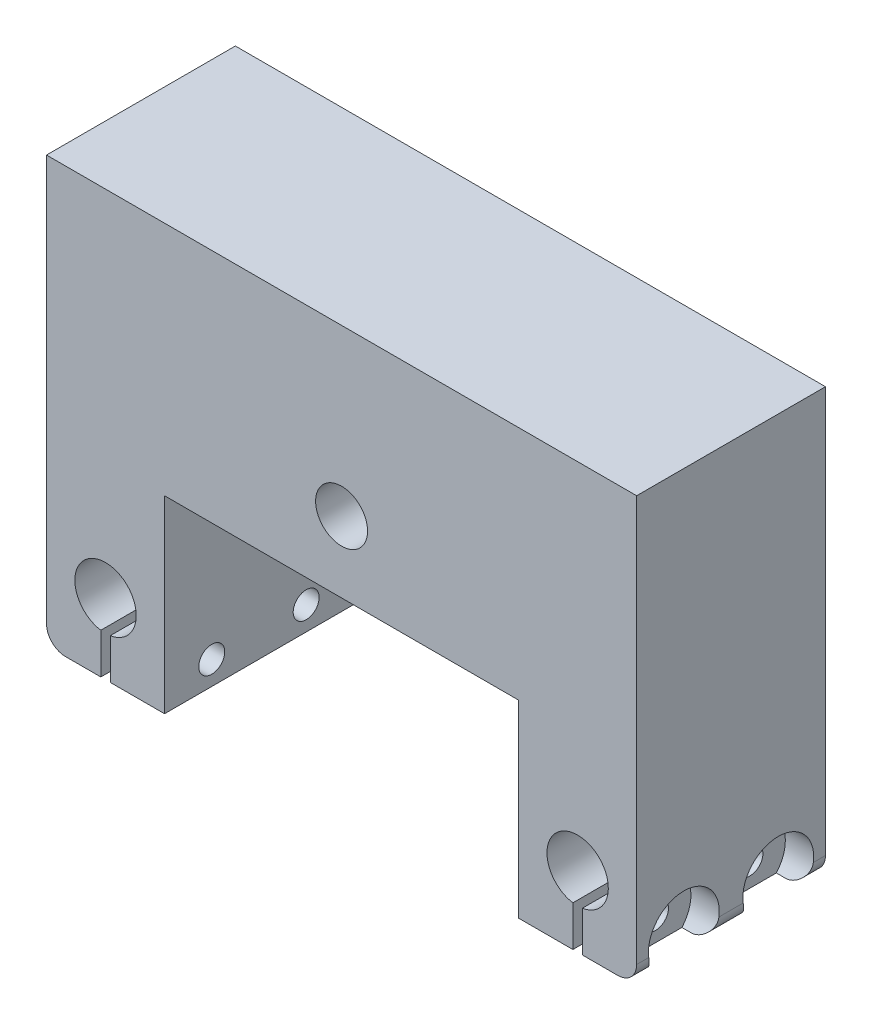
from build123d import *

# Parameters (mm, degrees)
SKETCH1_W           = 62.5
SKETCH1_H           = 45
BOSS_EXTRUDE1_DEPTH = 20
CUT_EXTRUDE10_DEPTH = 59.322915736
SKETCH18_W          = 37.5
SKETCH18_H          = 20
CUT_EXTRUDE13_DEPTH = 59.322915736
SKETCH19_R          = 2.75
CUT_EXTRUDE14_DEPTH = 59.322915736
SKETCH20_R          = 1.375
CUT_EXTRUDE15_DEPTH = 80.569152314
FILLET1_R           = 2
SKETCH21_R          = 3.75
CUT_EXTRUDE16_DEPTH = 3


with BuildPart() as part:
    # Sketch1 → Boss-Extrude1 (new body)
    with BuildSketch(Plane.XY):
        with Locations((0, 22.5)):
            Rectangle(SKETCH1_W, SKETCH1_H)
    extrude(amount=BOSS_EXTRUDE1_DEPTH)

    # Sketch14 → Cut-Extrude10 (cut, through all)
    with BuildSketch(Plane.XY.offset(20)):
        with BuildLine():
            ThreePointArc((24.5, 4.288691855), (24.749252587, 4.259687402), (25, 4.25))
            Line((25, 4.25), (25, 10.75))
            ThreePointArc((25, 10.75), (21.759687402, 7.750747413), (24.5, 4.288691855))
        make_face()
        with BuildLine():
            Line((25, 10.75), (25, 4.25))
            ThreePointArc((25, 4.25), (25.250747413, 4.259687402), (25.5, 4.288691855))
            ThreePointArc((25.5, 4.288691855), (27.468552207, 5.386058184), (28.25, 7.5))
            ThreePointArc((28.25, 7.5), (27.298097039, 9.798097039), (25, 10.75))
        make_face()
        with BuildLine():
            Line((24.5, 0), (25, 0))
            Line((25, 0), (25, 4.25))
            ThreePointArc((25, 4.25), (24.749252587, 4.259687402), (24.5, 4.288691855))
            Line((24.5, 4.288691855), (24.5, 0))
        make_face()
        with BuildLine():
            Line((25, 4.25), (25, 0))
            Line((25, 0), (25.5, 0))
            Line((25.5, 0), (25.5, 4.288691855))
            ThreePointArc((25.5, 4.288691855), (25.250747413, 4.259687402), (25, 4.25))
        make_face()
    cut_extrude10 = extrude(amount=-CUT_EXTRUDE10_DEPTH, mode=Mode.SUBTRACT)

    # Mirror1: Cut-Extrude10 across plane
    add(cut_extrude10.mirror(Plane(origin=(0, 0, 0), x_dir=(0, 0, 1), z_dir=(1, 0, 0))), mode=Mode.SUBTRACT)

    # Sketch18 → Cut-Extrude13 (cut, through all)
    with BuildSketch(Plane.XY.offset(20)):
        with Locations((0, 10)):
            Rectangle(SKETCH18_W, SKETCH18_H)
    extrude(amount=-CUT_EXTRUDE13_DEPTH, mode=Mode.SUBTRACT)

    # Sketch19 → Cut-Extrude14 (cut, through all)
    with BuildSketch(Plane.XY.offset(20)):
        with Locations((0, 27.5)):
            Circle(SKETCH19_R)
    extrude(amount=-CUT_EXTRUDE14_DEPTH, mode=Mode.SUBTRACT)

    # Sketch20 → Cut-Extrude15 (cut, through all)
    with BuildSketch(Plane(origin=(31.25, 0, 0), x_dir=(0, 0, -1), z_dir=(1, 0, 0))):
        with Locations(Location((-5, 2.5, 0), (0, 0, 180))):
            Circle(SKETCH20_R)
        with Locations(Location((-15, 2.5, 0), (0, 0, 180))):
            Circle(SKETCH20_R)
    extrude(amount=-CUT_EXTRUDE15_DEPTH, mode=Mode.SUBTRACT)

    # Fillet1
    # the kernel refuses this fillet: 2 mm, written as the material it takes off along each edge
    with BuildSketch(Plane(origin=(31.25, 0, -5), x_dir=(0, 1, 0), z_dir=(0, 0, 1)), Plane(origin=(-31.25, 0, -5), x_dir=(1, 0, 0), z_dir=(0, 0, 1))) as fillet1_piece_1:
        with BuildLine():
            CenterArc((FILLET1_R, FILLET1_R), FILLET1_R, 180, 90)
            Line((0, FILLET1_R), (0, 0))
            Line((0, 0), (FILLET1_R, 0))
        make_face()
    extrude(amount=30, mode=Mode.SUBTRACT)

    # Sketch21 → Cut-Extrude16 (cut)
    with BuildSketch(Plane(origin=(31.25, 0, 0), x_dir=(0, 0, -1), z_dir=(1, 0, 0))):
        with Locations((-5, 2.5)):
            Circle(SKETCH21_R)
        with Locations((-15, 2.5)):
            Circle(SKETCH21_R)
    cut_extrude16 = extrude(amount=-CUT_EXTRUDE16_DEPTH, mode=Mode.SUBTRACT)

    # Mirror2: Cut-Extrude16 across plane
    add(cut_extrude16.mirror(Plane(origin=(0, 0, 0), x_dir=(0, 0, 1), z_dir=(1, 0, 0))), mode=Mode.SUBTRACT)


solid = part.part
